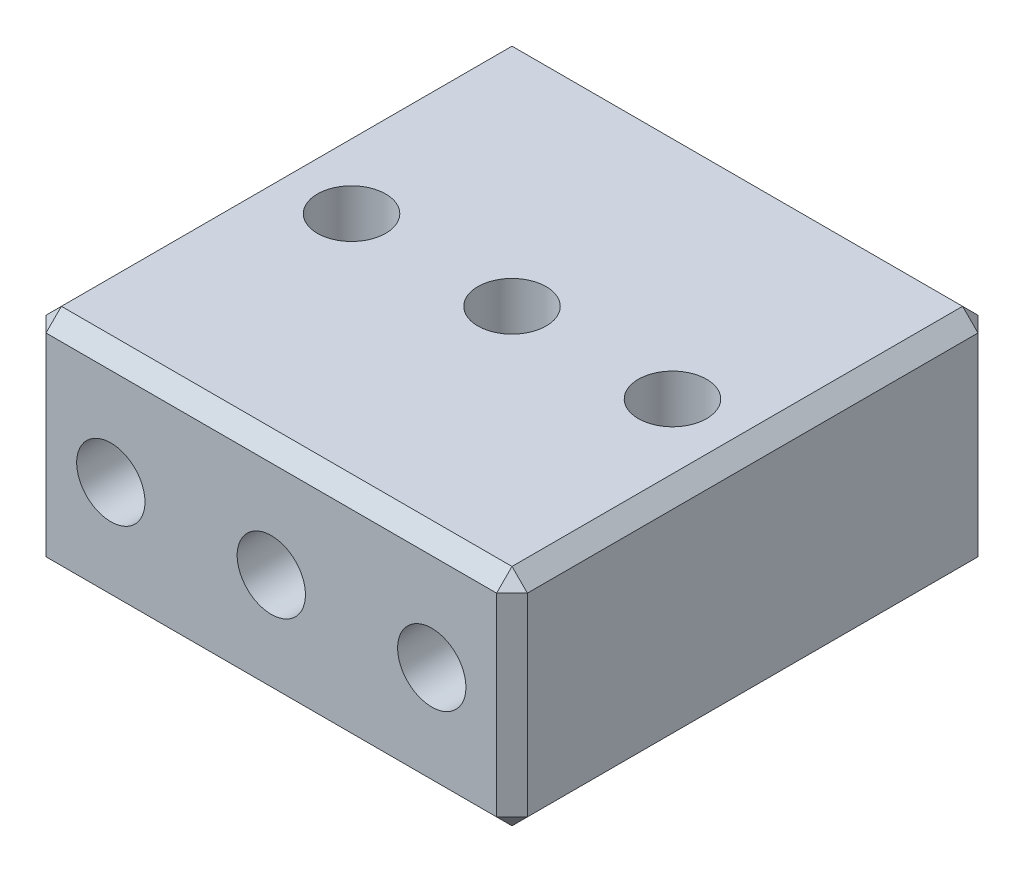
from build123d import *

# Parameters (mm, degrees)
SKETCH1_W               = 47.625
SKETCH1_H               = 22.225
BOSS_EXTRUDE1_DEPTH     = 23.8125
F_1_4_CLEARANCE_HOLE1_D = 6.7564
F_1_4_CLEARANCE_HOLE2_D = 6.7564
CHAMFER1_SIZE           = 1.524


with BuildPart() as part:
    # Sketch1 → Boss-Extrude1 (new, symmetric)
    with BuildSketch(Plane(origin=(0, 0, 0), x_dir=(0, 0, -1), z_dir=(1, 0, 0))):
        Rectangle(SKETCH1_W, SKETCH1_H)
    extrude(amount=BOSS_EXTRUDE1_DEPTH, both=True)

    # 1/4 Clearance Hole1 (through all)
    with Locations(Plane.XY.offset(23.8125)):
        with Locations((0, 0), (-15.875, 0), (15.875, 0)):
            Hole(F_1_4_CLEARANCE_HOLE1_D / 2)

    # 1/4 Clearance Hole2 (through all)
    with Locations(Plane(origin=(0, 11.1125, 0), x_dir=(1, 0, 0), z_dir=(0, 1, 0))):
        with Locations((-15.875, 0), (15.875, 0), (0, 0)):
            Hole(F_1_4_CLEARANCE_HOLE2_D / 2)

    # Chamfer1
    chamfer1_edges = [part.edges().sort_by_distance(p)[0] for p in [
        (-23.8125, -11.1125, 0),
        (0, -11.1125, -23.8125),
        (-23.8125, 0, -23.8125),
        (0, 11.1125, -23.8125),
        (-23.8125, 11.1125, 0),
        (-23.8125, 0, 23.8125),
        (0, -11.1125, 23.8125),
        (23.8125, 0, -23.8125),
        (23.8125, -11.1125, 0),
        (23.8125, 11.1125, 0),
        (23.8125, 0, 23.8125),
        (0, 11.1125, 23.8125),
    ]]
    chamfer(chamfer1_edges, length=CHAMFER1_SIZE)


solid = part.part
